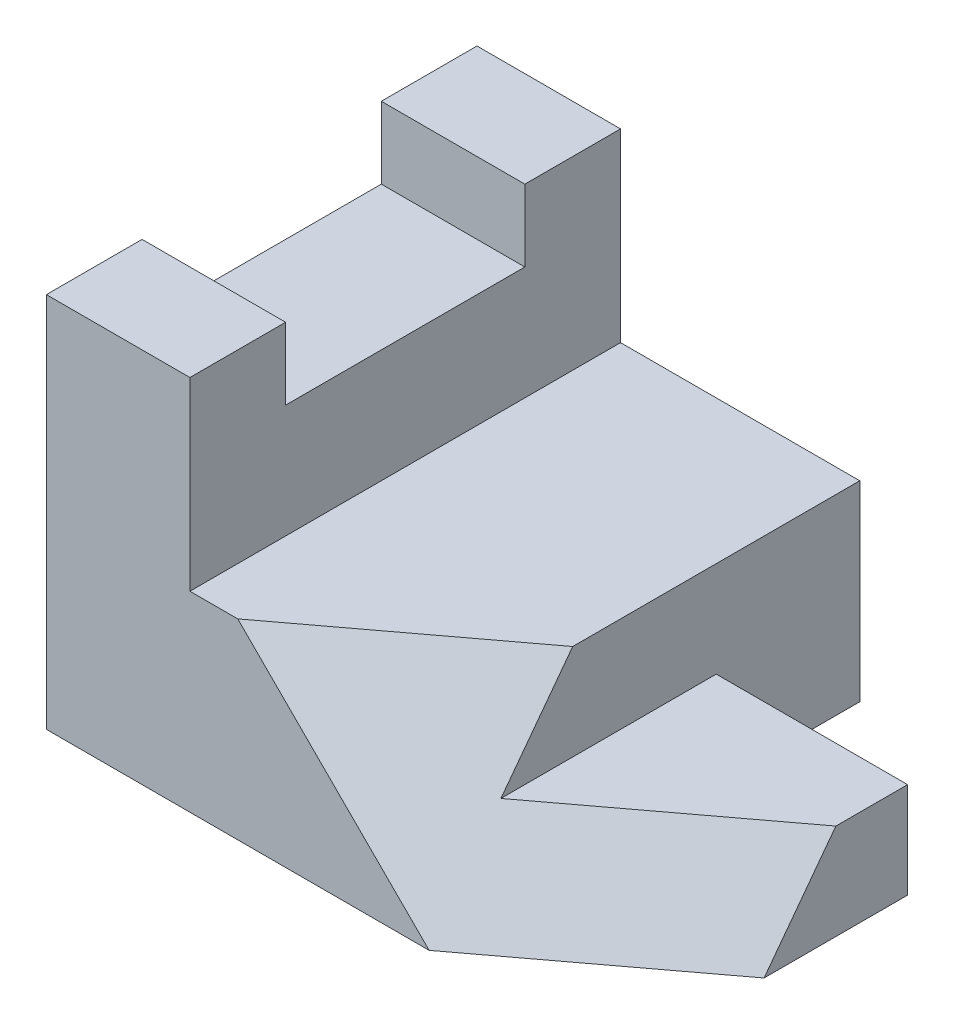
from build123d import *

# Parameters (mm, degrees)
BOSS_EXTRUDE1_DEPTH = 19.05
SKETCH2_W           = 57.15
SKETCH2_H           = 25.4
BOSS_EXTRUDE2_DEPTH = 31.75
SKETCH6_W           = 38.1
SKETCH6_H           = 12.7
BOSS_EXTRUDE3_DEPTH = 25.4
CUT_EXTRUDE1_START  = -18
CUT_EXTRUDE1_DEPTH  = 33.875


with BuildPart() as part:
    # Sketch1 → Boss-Extrude1 (new body)
    with BuildSketch(Plane(origin=(0, 0, 0), x_dir=(0, 0, -1), z_dir=(1, 0, 0))):
        Polygon((-15.875, 40.443322581), (15.875, 40.443322581), (15.875, 49.968322581), (28.575, 49.968322581), (28.575, 0), (-28.575, 0), (-28.575, 49.968322581), (-15.875, 49.968322581), align=None)
    extrude(amount=BOSS_EXTRUDE1_DEPTH)

    # Sketch2 → Boss-Extrude2 (add)
    with BuildSketch(Plane(origin=(19.05, 0, 0), x_dir=(0, 0, -1), z_dir=(1, 0, 0))):
        with Locations((0, 12.7)):
            Rectangle(SKETCH2_W, SKETCH2_H)
    extrude(amount=BOSS_EXTRUDE2_DEPTH)

    # Sketch6 → Boss-Extrude3 (add)
    with BuildSketch(Plane(origin=(50.8, 0, 0), x_dir=(0, 0, -1), z_dir=(1, 0, 0))):
        with Locations((-9.525, 6.35)):
            Rectangle(SKETCH6_W, SKETCH6_H)
    extrude(amount=BOSS_EXTRUDE3_DEPTH)

    # Cut-Extrude1: read off the stored shape, not the designer's step
    # Cut-Extrude1 outline → Cut-Extrude1 (cut)
    with BuildSketch(Plane(origin=(0, 0, 0), x_dir=(1, 0, 0), z_dir=(0, 0.7999999999999996, -0.6000000000000005)).offset(CUT_EXTRUDE1_START)):
        Polygon((24, -38.94), (24, -40), (76.2, -40), (76.2, -7.62), align=None)
    extrude(amount=CUT_EXTRUDE1_DEPTH, mode=Mode.SUBTRACT)


solid = part.part
